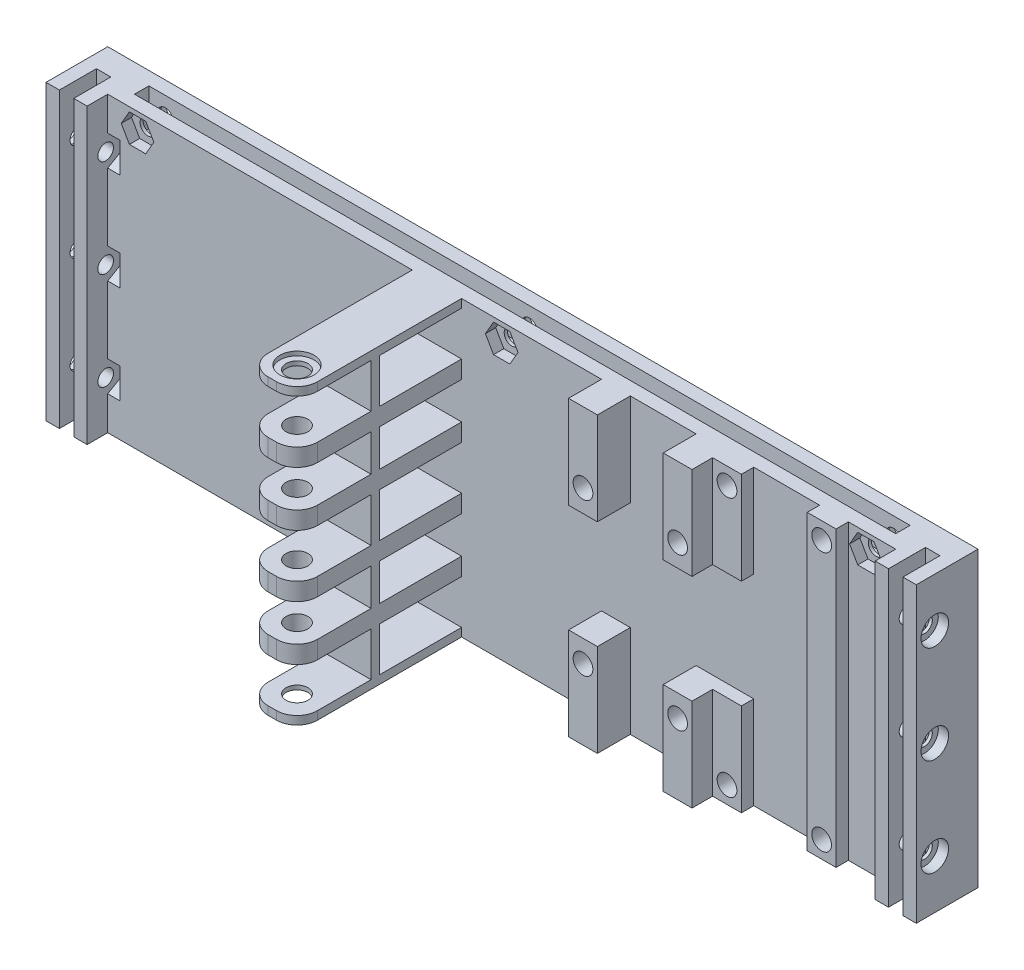
from build123d import *

# Parameters (mm, degrees)
SKETCH1_W                = 71.25
SKETCH1_H                = 12
BOSS_EXTRUDE1_DEPTH      = 10
SKETCH3_W                = 12
SKETCH3_H                = 2.025
SKETCH3_H_2              = 4.3
BOSS_EXTRUDE2_DEPTH      = 40
FILLET1_R                = 5
MIRROR1_START            = -58.525
MIRROR1_DEPTH            = 4.3
MIRROR1_START_2          = -45.275
MIRROR1_2_DEPTH          = 4.3
MIRROR1_START_3          = -71.25
MIRROR1_3_DEPTH          = 2.025
SKETCH5_R                = 2.65
CUT_EXTRUDE1_DEPTH       = 88.866731474
CUT_EXTRUDE2_DEPTH       = 1
SKETCH8_W                = 84
SKETCH8_H                = 71.25
SKETCH8_W_2              = 115.5
BOSS_EXTRUDE3_DEPTH      = 10
SKETCH9_W                = 10
SKETCH9_H                = 71.25
BOSS_EXTRUDE4_DEPTH      = 5
BOSS_EXTRUDE6_START      = 2.025
SKETCH13_W               = 12
SKETCH13_H               = 2
BOSS_EXTRUDE6_DEPTH      = 67.2
SKETCH14_W               = 185
SKETCH14_H               = 3.5
CUT_EXTRUDE4_DEPTH       = 9
CUT_EXTRUDE6_OUTLINE_R   = 3.35
CUT_EXTRUDE6_DEPTH       = 2.5
CUT_EXTRUDE6_START       = 2.5
CUT_EXTRUDE6_2_OUTLINE_R = 1.9
CUT_EXTRUDE6_2_DEPTH     = 7.5
CUT_EXTRUDE7_DEPTH       = 2.5
LPATTERN2_COUNT          = 3
LPATTERN2_PITCH          = 88.5
SKETCH21_W               = 7
SKETCH21_H               = 71.25
BOSS_EXTRUDE7_DEPTH      = 3
SKETCH23_W               = 7
SKETCH23_H               = 71.25
BOSS_EXTRUDE8_DEPTH      = 8
CUT_EXTRUDE8_REACH       = 146.626
SKETCH22_W               = 3.5
SKETCH22_H               = 9
LPATTERN3_COUNT          = 2
LPATTERN3_PITCH          = 201.5
SKETCH24_W               = 26.25
SKETCH24_H               = 8
CUT_EXTRUDE9_DEPTH       = 37
SKETCH26_R               = 2.4
CUT_EXTRUDE10_DEPTH      = 3.8
SKETCH31_R               = 1.75
CUT_EXTRUDE15_DEPTH      = 0.6
SKETCH27_R               = 2.4
CUT_EXTRUDE11_DEPTH      = 3.8
SKETCH32_R               = 1.75
CUT_EXTRUDE16_DEPTH      = 0.6
LPATTERN4_COUNT          = 2
LPATTERN4_PITCH          = 23
MIRROR4_COPY_1_SKETCH_R  = 2.4
MIRROR4_COPY_1_DEPTH     = 3.8
MIRROR4_COPY_2_SKETCH_R  = 1.75
MIRROR4_COPY_2_DEPTH     = 0.6
MIRROR4_COPY_3_SKETCH_R  = 2.4
MIRROR4_COPY_3_DEPTH     = 3.8
MIRROR4_COPY_4_SKETCH_R  = 1.75
MIRROR4_COPY_4_DEPTH     = 0.6
SKETCH28_R               = 1.9
CUT_EXTRUDE12_DEPTH      = 10
SKETCH29_R               = 3.35
CUT_EXTRUDE13_DEPTH      = 2.5
CUT_EXTRUDE14_DEPTH      = 3
LPATTERN5_COUNT          = 3
LPATTERN5_PITCH          = 23.75
MIRROR5_COPY_1_SKETCH_R  = 1.9
MIRROR5_COPY_1_DEPTH     = 10
MIRROR5_COPY_2_SKETCH_R  = 1.9
MIRROR5_COPY_2_DEPTH     = 10
MIRROR5_COPY_3_SKETCH_R  = 3.35
MIRROR5_COPY_3_DEPTH     = 2.5
MIRROR5_COPY_4_SKETCH_R  = 3.35
MIRROR5_COPY_4_DEPTH     = 2.5
MIRROR5_COPY_5_DEPTH     = 3
MIRROR5_COPY_6_DEPTH     = 3


# Read off the part's stored shape, not the designer's step: Mirror1, Cut-Extrude6
with BuildPart() as part:
    # Sketch1 → Boss-Extrude1 (new body)
    with BuildSketch(Plane(origin=(0, 0, 0), x_dir=(0, 1, 0), z_dir=(0, 0, 1))):
        with Locations((-35.625, 6)):
            Rectangle(SKETCH1_W, SKETCH1_H)
    extrude(amount=BOSS_EXTRUDE1_DEPTH)

    # Sketch3 → Boss-Extrude2 (add)
    with BuildSketch(Plane.XY.offset(10)):
        with Locations((-6, -1.0125)):
            Rectangle(SKETCH3_W, SKETCH3_H)
        with Locations((-6, -14.875)):
            Rectangle(SKETCH3_W, SKETCH3_H_2)
        with Locations((-6, -28.125)):
            Rectangle(SKETCH3_W, SKETCH3_H_2)
    extrude(amount=BOSS_EXTRUDE2_DEPTH)

    # Fillet1
    fillet1_edges = [part.edges().sort_by_distance(p)[0] for p in [
        (-12, -1.0125, 50),
        (0, -1.0125, 50),
        (0, -14.875, 50),
        (-12, -14.875, 50),
        (0, -28.125, 50),
        (-12, -28.125, 50),
    ]]
    fillet(fillet1_edges, radius=FILLET1_R)

    # Mirror1 outline → Mirror1 (add)
    with BuildSketch(Plane(origin=(0, 0, 0), x_dir=(1, 0, 0), z_dir=(0, 1, 0)).offset(MIRROR1_START)):
        with BuildLine():
            Line((-12, -10), (-12, -45))
            ThreePointArc((-12, -45), (-10.535533906, -48.535533906), (-7, -50))
            Line((-7, -50), (-5, -50))
            ThreePointArc((-5, -50), (-1.464466094, -48.535533906), (0, -45))
            Line((0, -45), (0, -10))
            Line((0, -10), (-12, -10))
        make_face()
    extrude(amount=MIRROR1_DEPTH)

    # Mirror1 2 outline → Mirror1 2 (add)
    with BuildSketch(Plane(origin=(0, 0, 0), x_dir=(1, 0, 0), z_dir=(0, 1, 0)).offset(MIRROR1_START_2)):
        with BuildLine():
            Line((-12, -10), (-12, -45))
            ThreePointArc((-12, -45), (-10.535533906, -48.535533906), (-7, -50))
            Line((-7, -50), (-5, -50))
            ThreePointArc((-5, -50), (-1.464466094, -48.535533906), (0, -45))
            Line((0, -45), (0, -10))
            Line((0, -10), (-12, -10))
        make_face()
    extrude(amount=MIRROR1_2_DEPTH)

    # Mirror1 3 outline → Mirror1 3 (add)
    with BuildSketch(Plane(origin=(0, 0, 0), x_dir=(1, 0, 0), z_dir=(0, 1, 0)).offset(MIRROR1_START_3)):
        with BuildLine():
            Line((-12, -10), (-12, -45))
            ThreePointArc((-12, -45), (-10.535533906, -48.535533906), (-7, -50))
            Line((-7, -50), (-5, -50))
            ThreePointArc((-5, -50), (-1.464466094, -48.535533906), (0, -45))
            Line((0, -45), (0, -10))
            Line((0, -10), (-12, -10))
        make_face()
    extrude(amount=MIRROR1_3_DEPTH)

    # Sketch5 → Cut-Extrude1 (cut, through all)
    with BuildSketch(Plane(origin=(0, 0, 0), x_dir=(-1, 0, 0), z_dir=(0, 1, 0))):
        with Locations(Location((6, 44, 0), (0, 0, 90))):
            Circle(SKETCH5_R)
    extrude(amount=-CUT_EXTRUDE1_DEPTH, mode=Mode.SUBTRACT)

    # Sketch7 → Cut-Extrude2 (cut)
    with BuildSketch(Plane(origin=(0, 0, 0), x_dir=(-1, 0, 0), z_dir=(0, 1, 0))):
        with BuildLine():
            ThreePointArc((10.15, 44), (8.934493142, 46.934493142), (6, 48.15))
            Line((6, 48.15), (6, 46.65))
            ThreePointArc((6, 46.65), (7.87383297, 45.87383297), (8.65, 44))
            ThreePointArc((8.65, 44), (6, 41.35), (3.35, 44))
            Line((3.35, 44), (1.85, 44))
            ThreePointArc((1.85, 44), (6, 39.85), (10.15, 44))
        make_face()
        with BuildLine():
            Line((6, 46.65), (6, 48.15))
            ThreePointArc((6, 48.15), (3.065506858, 46.934493142), (1.85, 44))
            Line((1.85, 44), (3.35, 44))
            ThreePointArc((3.35, 44), (4.12616703, 45.87383297), (6, 46.65))
        make_face()
    cut_extrude2 = extrude(amount=-CUT_EXTRUDE2_DEPTH, mode=Mode.SUBTRACT)

    # Mirror2: Cut-Extrude2 across plane
    add(cut_extrude2.mirror(Plane.ZX.offset(-35.625)), mode=Mode.SUBTRACT)

    # Sketch8 → Boss-Extrude3 (add)
    with BuildSketch(Plane(origin=(0, 0, 0), x_dir=(1, 0, 0), z_dir=(0, 0, -1))):
        with Locations((-54, 35.625)):
            Rectangle(SKETCH8_W, SKETCH8_H)
        with Locations((57.75, 35.625)):
            Rectangle(SKETCH8_W_2, SKETCH8_H)
    extrude(amount=-BOSS_EXTRUDE3_DEPTH)

    # Sketch9 → Boss-Extrude4 (add)
    with BuildSketch(Plane.XY.offset(10)):
        with Locations((110.5, -35.625)):
            Rectangle(SKETCH9_W, SKETCH9_H)
        with Locations((-91, -35.625)):
            Rectangle(SKETCH9_W, SKETCH9_H)
    extrude(amount=BOSS_EXTRUDE4_DEPTH)

    # Sketch13 → Boss-Extrude6 (add)
    with BuildSketch(Plane(origin=(0, -71.25, 0), x_dir=(-1, 0, 0), z_dir=(0, 1, 0)).offset(BOSS_EXTRUDE6_START)):
        with Locations((6, 31)):
            Rectangle(SKETCH13_W, SKETCH13_H)
    extrude(amount=BOSS_EXTRUDE6_DEPTH)

    # Sketch14 → Cut-Extrude4 (cut)
    with BuildSketch(Plane(origin=(0, 0, 0), x_dir=(-1, 0, 0), z_dir=(0, 1, 0))):
        with Locations((-9.75, 5)):
            Rectangle(SKETCH14_W, SKETCH14_H)
    cut_extrude4 = extrude(amount=-CUT_EXTRUDE4_DEPTH, mode=Mode.SUBTRACT)

    # Mirror3: Cut-Extrude4 across plane
    add(cut_extrude4.mirror(Plane.ZX.offset(-35.625)), mode=Mode.SUBTRACT)

    # Cut-Extrude6 outline → Cut-Extrude6 (cut)
    with BuildSketch(Plane.XY):
        with Locations((-78.75, -4.5)):
            Circle(CUT_EXTRUDE6_OUTLINE_R)
    cut_extrude6 = extrude(amount=CUT_EXTRUDE6_DEPTH, mode=Mode.SUBTRACT)

    # Cut-Extrude6 2 outline → Cut-Extrude6 2 (cut)
    with BuildSketch(Plane.XY.offset(CUT_EXTRUDE6_START)):
        with Locations((-78.75, -4.5)):
            Circle(CUT_EXTRUDE6_2_OUTLINE_R)
    cut_extrude6_2 = extrude(amount=CUT_EXTRUDE6_2_DEPTH, mode=Mode.SUBTRACT)

    # Sketch20 → Cut-Extrude7 (cut)
    with BuildSketch(Plane(origin=(19.6145137, 61.498251456, 10), x_dir=(1, 0, 0), z_dir=(0, 0, 1))):
        Polygon((-94.402633485, -65.998251456), (-96.383573592, -62.567162542), (-100.345453808, -62.567162542), (-102.326393915, -65.998251456), (-100.345453808, -69.429340369), (-96.383573592, -69.429340369), align=None)
    cut_extrude7 = extrude(amount=-CUT_EXTRUDE7_DEPTH, mode=Mode.SUBTRACT)

    # LPattern2: Cut-Extrude6, Cut-Extrude6 2, Cut-Extrude7 ×3
    with Locations(*[(i * LPATTERN2_PITCH, 0, 0) for i in range(1, LPATTERN2_COUNT)]):
        add(cut_extrude6, mode=Mode.SUBTRACT)
        add(cut_extrude6_2, mode=Mode.SUBTRACT)
        add(cut_extrude7, mode=Mode.SUBTRACT)

    # Sketch21 → Boss-Extrude7 (add)
    with BuildSketch(Plane.XY.offset(10)):
        with Locations((90.5, -35.625)):
            Rectangle(SKETCH21_W, SKETCH21_H)
        with Locations((67.5, -35.625)):
            Rectangle(SKETCH21_W, SKETCH21_H)
    extrude(amount=BOSS_EXTRUDE7_DEPTH)

    # Sketch23 → Boss-Extrude8 (add)
    with BuildSketch(Plane.XY.offset(10)):
        with Locations((37.5, -35.625)):
            Rectangle(SKETCH23_W, SKETCH23_H)
        with Locations((60.5, -35.625)):
            Rectangle(SKETCH23_W, SKETCH23_H)
    extrude(amount=BOSS_EXTRUDE8_DEPTH)

    # Sketch22 → Cut-Extrude8 (cut, up to next)
    with BuildSketch(Plane(origin=(0, 0, 0), x_dir=(-1, 0, 0), z_dir=(0, 1, 0)), mode=Mode.PRIVATE) as cut_extrude8_sk1:
        with Locations((-110.5, 10.5)):
            Rectangle(SKETCH22_W, SKETCH22_H)
    cut_extrude8_tool1 = extrude(cut_extrude8_sk1.sketch, amount=-CUT_EXTRUDE8_REACH, mode=Mode.PRIVATE) & part.part
    cut_extrude8 = cut_extrude8_tool1.solids().sort_by_distance((110.5, 0, 10.5))[0]
    add(cut_extrude8, mode=Mode.SUBTRACT)

    # LPattern3: Cut-Extrude8 ×2
    with Locations(*[(-i * LPATTERN3_PITCH, 0, 0) for i in range(1, LPATTERN3_COUNT)]):
        add(cut_extrude8, mode=Mode.SUBTRACT)

    # Sketch24 → Cut-Extrude9 (cut)
    with BuildSketch(Plane(origin=(34, 0, 0), x_dir=(0, -1, 0), z_dir=(-1, 0, 0))):
        with Locations((35.625, 14)):
            Rectangle(SKETCH24_W, SKETCH24_H)
    extrude(amount=-CUT_EXTRUDE9_DEPTH, mode=Mode.SUBTRACT)

    # Sketch26 → Cut-Extrude10 (cut)
    with BuildSketch(Plane.XY.offset(13)):
        with Locations((90.5, -4.125)):
            Circle(SKETCH26_R)
    cut_extrude10 = extrude(amount=-CUT_EXTRUDE10_DEPTH, mode=Mode.SUBTRACT)

    # Sketch31 → Cut-Extrude15 (cut)
    with BuildSketch(Plane.XY.offset(9.2)):
        with Locations((90.5, -4.125)):
            Circle(SKETCH31_R)
    cut_extrude15 = extrude(amount=-CUT_EXTRUDE15_DEPTH, mode=Mode.SUBTRACT)

    # Sketch27 → Cut-Extrude11 (cut)
    with BuildSketch(Plane.XY.offset(18)):
        with Locations((60.5, -17.125)):
            Circle(SKETCH27_R)
    cut_extrude11 = extrude(amount=-CUT_EXTRUDE11_DEPTH, mode=Mode.SUBTRACT)

    # Sketch32 → Cut-Extrude16 (cut)
    with BuildSketch(Plane.XY.offset(14.2)):
        with Locations((60.5, -17.125)):
            Circle(SKETCH32_R)
    cut_extrude16 = extrude(amount=-CUT_EXTRUDE16_DEPTH, mode=Mode.SUBTRACT)

    # LPattern4: Cut-Extrude10, Cut-Extrude15, Cut-Extrude11, Cut-Extrude16 ×2
    with Locations(*[(-i * LPATTERN4_PITCH, 0, 0) for i in range(1, LPATTERN4_COUNT)]):
        add(cut_extrude10, mode=Mode.SUBTRACT)
        add(cut_extrude15, mode=Mode.SUBTRACT)
        add(cut_extrude11, mode=Mode.SUBTRACT)
        add(cut_extrude16, mode=Mode.SUBTRACT)

    # Mirror4: Cut-Extrude10, Cut-Extrude15, Cut-Extrude11, Cut-Extrude16 across plane
    add(cut_extrude10.mirror(Plane.ZX.offset(-35.625)), mode=Mode.SUBTRACT)
    add(cut_extrude15.mirror(Plane.ZX.offset(-35.625)), mode=Mode.SUBTRACT)
    add(cut_extrude11.mirror(Plane.ZX.offset(-35.625)), mode=Mode.SUBTRACT)
    add(cut_extrude16.mirror(Plane.ZX.offset(-35.625)), mode=Mode.SUBTRACT)

    # Mirror4 copy 1 sketch → Mirror4 copy 1 (cut)
    with BuildSketch(Plane(origin=(-23, -71.25, 13), x_dir=(1, 0, 0), z_dir=(0, 0, 1))):
        with Locations((90.5, 4.125)):
            Circle(MIRROR4_COPY_1_SKETCH_R)
    extrude(amount=-MIRROR4_COPY_1_DEPTH, mode=Mode.SUBTRACT)

    # Mirror4 copy 2 sketch → Mirror4 copy 2 (cut)
    with BuildSketch(Plane(origin=(-23, -71.25, 9.2), x_dir=(1, 0, 0), z_dir=(0, 0, 1))):
        with Locations((90.5, 4.125)):
            Circle(MIRROR4_COPY_2_SKETCH_R)
    extrude(amount=-MIRROR4_COPY_2_DEPTH, mode=Mode.SUBTRACT)

    # Mirror4 copy 3 sketch → Mirror4 copy 3 (cut)
    with BuildSketch(Plane(origin=(-23, -71.25, 18), x_dir=(1, 0, 0), z_dir=(0, 0, 1))):
        with Locations((60.5, 17.125)):
            Circle(MIRROR4_COPY_3_SKETCH_R)
    extrude(amount=-MIRROR4_COPY_3_DEPTH, mode=Mode.SUBTRACT)

    # Mirror4 copy 4 sketch → Mirror4 copy 4 (cut)
    with BuildSketch(Plane(origin=(-23, -71.25, 14.2), x_dir=(1, 0, 0), z_dir=(0, 0, 1))):
        with Locations((60.5, 17.125)):
            Circle(MIRROR4_COPY_4_SKETCH_R)
    extrude(amount=-MIRROR4_COPY_4_DEPTH, mode=Mode.SUBTRACT)

    # Sketch28 → Cut-Extrude12 (cut)
    with BuildSketch(Plane.YZ.offset(115.5)):
        with Locations((-11.875, 10.5)):
            Circle(SKETCH28_R)
    cut_extrude12 = extrude(amount=-CUT_EXTRUDE12_DEPTH, mode=Mode.SUBTRACT)

    # Sketch29 → Cut-Extrude13 (cut)
    with BuildSketch(Plane.YZ.offset(115.5)):
        with Locations((-11.875, 10.5)):
            Circle(SKETCH29_R)
    cut_extrude13 = extrude(amount=-CUT_EXTRUDE13_DEPTH, mode=Mode.SUBTRACT)

    # Sketch30 → Cut-Extrude14 (cut)
    with BuildSketch(Plane(origin=(105.5, 0, 0), x_dir=(0, -1, 0), z_dir=(-1, 0, 0))):
        Polygon((9.894059892, 13.931088913), (7.913119785, 10.5), (9.894059892, 7.068911087), (13.855940108, 7.068911087), (15.836880215, 10.5), (13.855940108, 13.931088913), align=None)
    cut_extrude14 = extrude(amount=CUT_EXTRUDE14_DEPTH, mode=Mode.SUBTRACT)

    # LPattern5: Cut-Extrude12, Cut-Extrude13, Cut-Extrude14 ×3
    with Locations(*[(0, -i * LPATTERN5_PITCH, 0) for i in range(1, LPATTERN5_COUNT)]):
        add(cut_extrude12, mode=Mode.SUBTRACT)
        add(cut_extrude13, mode=Mode.SUBTRACT)
        add(cut_extrude14, mode=Mode.SUBTRACT)

    # Mirror5: Cut-Extrude12, Cut-Extrude13, Cut-Extrude14 across plane
    add(cut_extrude12.mirror(Plane(origin=(9.75, 0, 0), x_dir=(0, 0, 1), z_dir=(1, 0, 0))), mode=Mode.SUBTRACT)
    add(cut_extrude13.mirror(Plane(origin=(9.75, 0, 0), x_dir=(0, 0, 1), z_dir=(1, 0, 0))), mode=Mode.SUBTRACT)
    add(cut_extrude14.mirror(Plane(origin=(9.75, 0, 0), x_dir=(0, 0, 1), z_dir=(1, 0, 0))), mode=Mode.SUBTRACT)

    # Mirror5 copy 1 sketch → Mirror5 copy 1 (cut)
    with BuildSketch(Plane(origin=(-96, -23.75, 0), x_dir=(0, 1, 0), z_dir=(-1, 0, 0))):
        with Locations((-11.875, -10.5)):
            Circle(MIRROR5_COPY_1_SKETCH_R)
    extrude(amount=-MIRROR5_COPY_1_DEPTH, mode=Mode.SUBTRACT)

    # Mirror5 copy 2 sketch → Mirror5 copy 2 (cut)
    with BuildSketch(Plane(origin=(-96, -47.5, 0), x_dir=(0, 1, 0), z_dir=(-1, 0, 0))):
        with Locations((-11.875, -10.5)):
            Circle(MIRROR5_COPY_2_SKETCH_R)
    extrude(amount=-MIRROR5_COPY_2_DEPTH, mode=Mode.SUBTRACT)

    # Mirror5 copy 3 sketch → Mirror5 copy 3 (cut)
    with BuildSketch(Plane(origin=(-96, -23.75, 0), x_dir=(0, 1, 0), z_dir=(-1, 0, 0))):
        with Locations((-11.875, -10.5)):
            Circle(MIRROR5_COPY_3_SKETCH_R)
    extrude(amount=-MIRROR5_COPY_3_DEPTH, mode=Mode.SUBTRACT)

    # Mirror5 copy 4 sketch → Mirror5 copy 4 (cut)
    with BuildSketch(Plane(origin=(-96, -47.5, 0), x_dir=(0, 1, 0), z_dir=(-1, 0, 0))):
        with Locations((-11.875, -10.5)):
            Circle(MIRROR5_COPY_4_SKETCH_R)
    extrude(amount=-MIRROR5_COPY_4_DEPTH, mode=Mode.SUBTRACT)

    # Mirror5 copy 5 sketch → Mirror5 copy 5 (cut)
    with BuildSketch(Plane(origin=(-86, -23.75, 0), x_dir=(0, -1, 0), z_dir=(1, 0, 0))):
        Polygon((9.894059892, -13.931088913), (7.913119785, -10.5), (9.894059892, -7.068911087), (13.855940108, -7.068911087), (15.836880215, -10.5), (13.855940108, -13.931088913), align=None)
    extrude(amount=MIRROR5_COPY_5_DEPTH, mode=Mode.SUBTRACT)

    # Mirror5 copy 6 sketch → Mirror5 copy 6 (cut)
    with BuildSketch(Plane(origin=(-86, -47.5, 0), x_dir=(0, -1, 0), z_dir=(1, 0, 0))):
        Polygon((9.894059892, -13.931088913), (7.913119785, -10.5), (9.894059892, -7.068911087), (13.855940108, -7.068911087), (15.836880215, -10.5), (13.855940108, -13.931088913), align=None)
    extrude(amount=MIRROR5_COPY_6_DEPTH, mode=Mode.SUBTRACT)


solid = part.part
